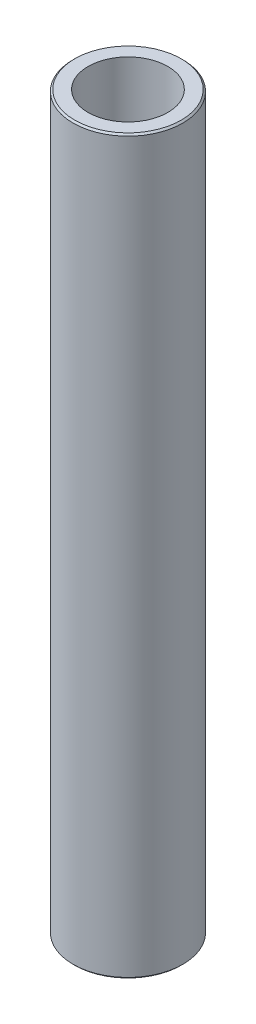
from build123d import *

# Parameters (mm, degrees)
SKETCH1_R           = 45
BOSS_EXTRUDE1_DEPTH = 600
SKETCH2_R           = 32.703360402
CUT_EXTRUDE1_DEPTH  = 604.365560834
CHAMFER1_SIZE       = 1.371204176


with BuildPart() as part:
    # Sketch1 → Boss-Extrude1 (new body)
    with BuildSketch(Plane(origin=(0, 0, 0), x_dir=(1, 0, 0), z_dir=(0, 1, 0))):
        Circle(SKETCH1_R)
    extrude(amount=BOSS_EXTRUDE1_DEPTH)

    # Sketch2 → Cut-Extrude1 (cut, through all)
    with BuildSketch(Plane(origin=(0, 0, 0), x_dir=(1, 0, 0), z_dir=(0, 1, 0))):
        Circle(SKETCH2_R)
    extrude(amount=CUT_EXTRUDE1_DEPTH, mode=Mode.SUBTRACT)

    # Chamfer1
    chamfer1_edges = [part.edges().sort_by_distance(p)[0] for p in [
        (-45, 600, 0),
        (-45, 0, 0),
    ]]
    chamfer(chamfer1_edges, length=CHAMFER1_SIZE)


solid = part.part
